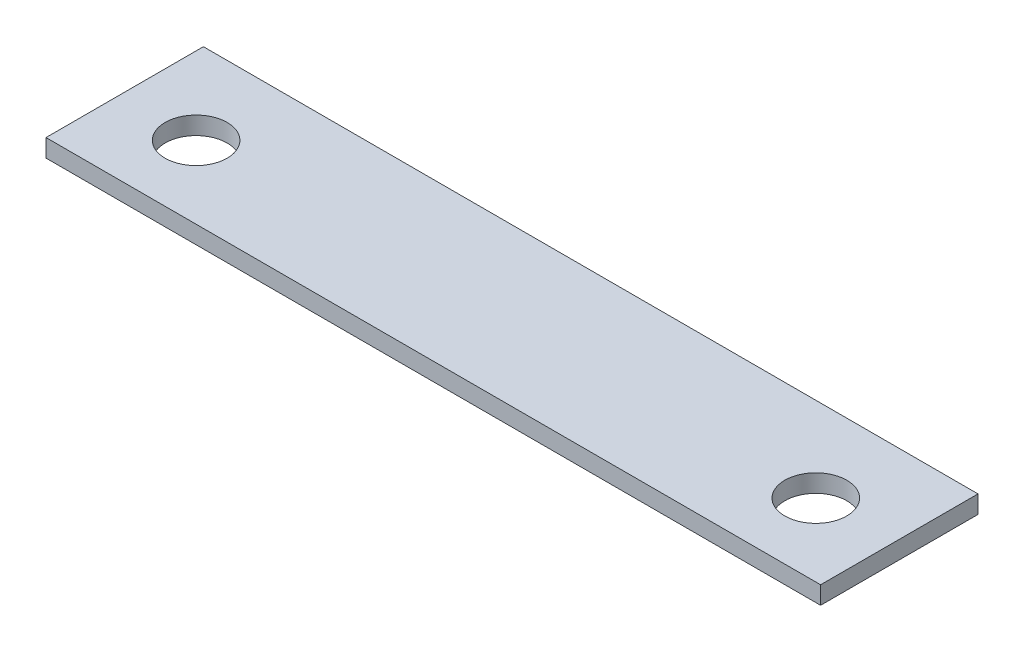
from build123d import *

# Parameters (mm, degrees)
SKETCH1_W           = 125
SKETCH1_H           = 25.4
BOSS_EXTRUDE1_DEPTH = 2.875
CUT_EXTRUDE1_REACH  = 65.842
SKETCH2_R           = 5


with BuildPart() as part:
    # Sketch1 → Boss-Extrude1 (new body)
    with BuildSketch(Plane(origin=(0, 0, 0), x_dir=(1, 0, 0), z_dir=(0, 1, 0))):
        Rectangle(SKETCH1_W, SKETCH1_H)
    extrude(amount=BOSS_EXTRUDE1_DEPTH)

    # Sketch2 → Cut-Extrude1 (cut, up to next)
    with BuildSketch(Plane.XZ, mode=Mode.PRIVATE) as cut_extrude1_sk1:
        with Locations((-50, 0.975)):
            Circle(SKETCH2_R)
    cut_extrude1_tool1 = extrude(cut_extrude1_sk1.sketch, amount=-CUT_EXTRUDE1_REACH, mode=Mode.PRIVATE) & part.part
    # Sketch2 → Cut-Extrude1 (cut, up to next)
    with BuildSketch(Plane.XZ, mode=Mode.PRIVATE) as cut_extrude1_sk2:
        with Locations((50, 0.975)):
            Circle(SKETCH2_R)
    cut_extrude1_tool2 = extrude(cut_extrude1_sk2.sketch, amount=-CUT_EXTRUDE1_REACH, mode=Mode.PRIVATE) & part.part
    add(cut_extrude1_tool1.solids().sort_by_distance((-50, 0, 0.975))[0], mode=Mode.SUBTRACT)
    add(cut_extrude1_tool2.solids().sort_by_distance((50, 0, 0.975))[0], mode=Mode.SUBTRACT)


solid = part.part
